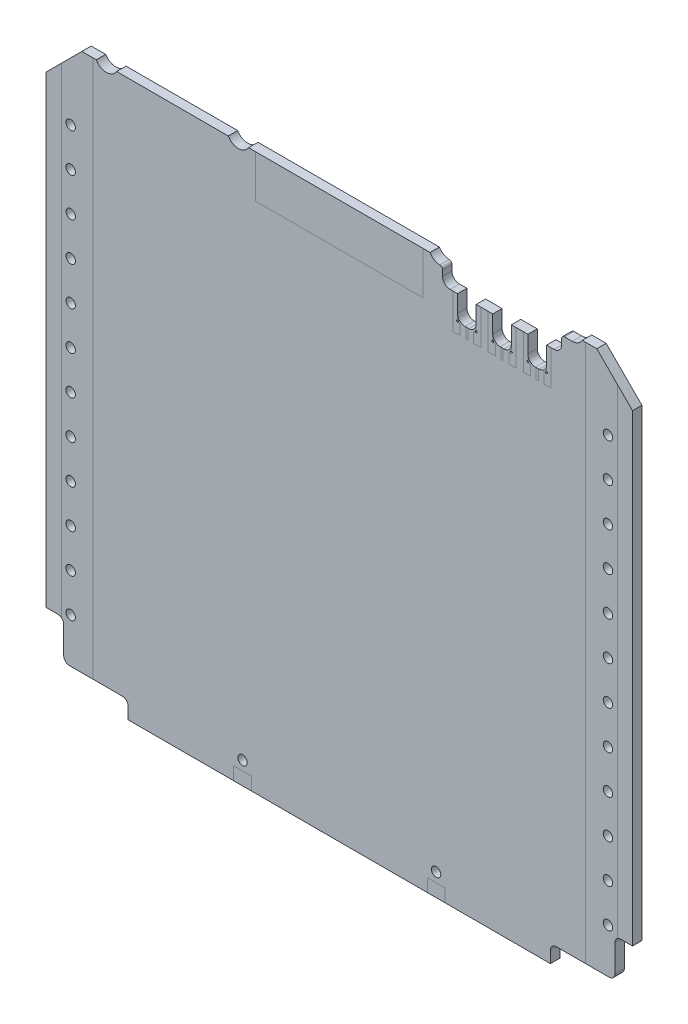
from build123d import *
from build123d.topology import SkipClean

# Parameters (mm, degrees)
SKETCH1_W                        = 100
SKETCH1_H                        = 94.75
BASICSIZE_DEPTH                  = 1.6
CHAMFER1_SIZE                    = 6.1
BACKPLANESIDESCREWCUTOUT_DEPTH   = 71.728777736
LPATTERN3_COUNT                  = 2
LPATTERN3_PITCH                  = 22.5
MIRROR3_COPY_1_DEPTH             = 71.728777736
CUT_EXTRUDE4_DEPTH               = 71.728777736
FILLET1_R                        = 1
FILLET1_OF_MIRROR1_R             = 1
SKETCH7_W                        = 28.575
SKETCH7_H                        = 7.293
TIGEREYEFOOTPRINT_DEPTH          = 0.0001
THERMALCONTACTS_UPPER_W          = 8.992158269
THERMALCONTACTS_UPPER_H          = 86.25
KEEPOUT_BOTTOM_DEPTH             = 0.0001
CAUTION_TOP_START                = -0.00015
CAUTION_TOP_DEPTH                = 0.00015
HOLD_DOWNLOCATIONS_W             = 3
HOLD_DOWNLOCATIONS_H             = 2.2
HOLD_DOWNFOOTPRINTS_DEPTH        = 0.0001
SKETCH10_W                       = 3
SKETCH10_H                       = 3.3
BOTTOMSIDESHELFKEEPOUTS_DEPTH    = 0.0001
SKETCH8_R                        = 0.8
SPRINGPINHOLESEED_DEPTH          = 10
SKETCH11_W                       = 3.18
SKETCH11_H                       = 4.2
CUT_EXTRUDE5_DEPTH               = 10
FILLET2_R                        = 1.27
F_0_32_0_32_DIAMETER_HOLE1_D     = 0.32
F_0_32_0_32_DIAMETER_HOLE1_DEPTH = 9.525
F_0_32_0_32_DIAMETER_HOLE1_TIP   = 0.096137699
SKETCH14_W                       = 0.38
SKETCH14_H                       = 1.79
BOSS_EXTRUDE1_DEPTH              = 0.0001
LPATTERN4_COUNT                  = 3
LPATTERN4_PITCH                  = 6
CUT_EXTRUDE6_DEPTH               = 71.728777736
CUT_EXTRUDE6_DEPTH_BACK          = 71.728777736
FILLET3_R                        = 0.5


# Read off the part's stored shape, not the designer's step: clearances_side-side
with BuildPart() as part:
    # Sketch1 → basicSize (new body)
    with BuildSketch(Plane(origin=(0, 0, -0.0125), x_dir=(-1, 0, 0), z_dir=(0, 0, -1))):
        with Locations((0, -2.625)):
            Rectangle(SKETCH1_W, SKETCH1_H)
    extrude(amount=-BASICSIZE_DEPTH)

    # Chamfer1
    chamfer1_edges = [part.edges().sort_by_distance(p)[0] for p in [
        (50, 44.75, 0.7875),
        (-50, 44.75, 0.7875),
    ]]
    chamfer(chamfer1_edges, length=CHAMFER1_SIZE)

    # Sketch4 → backplaneSideScrewCutout (cut, symmetric)
    with BuildSketch(Plane.XY.offset(1.5875)):
        with BuildLine():
            Line((37.967949192, 44.75), (41.432050808, 44.75))
            ThreePointArc((41.432050808, 44.75), (39.7, 43.75), (37.967949192, 44.75))
        make_face()
    backplanesidescrewcutout = extrude(amount=BACKPLANESIDESCREWCUTOUT_DEPTH, both=True, mode=Mode.SUBTRACT)

    # LPattern3: backplaneSideScrewCutout ×2
    with Locations(*[(-i * LPATTERN3_PITCH, 0, 0) for i in range(1, LPATTERN3_COUNT)]):
        add(backplanesidescrewcutout, mode=Mode.SUBTRACT)

    # Mirror3: backplaneSideScrewCutout across plane
    add(backplanesidescrewcutout.mirror(Plane(origin=(0, 0, 0), x_dir=(0, 0, 1), z_dir=(1, 0, 0))), mode=Mode.SUBTRACT)

    # Mirror3 copy 1 sketch → Mirror3 copy 1 (cut, symmetric)
    with BuildSketch(Plane(origin=(22.5, 0, 1.5875), x_dir=(-1, 0, 0), z_dir=(0, 0, 1))):
        with BuildLine():
            Line((37.967949192, -44.75), (41.432050808, -44.75))
            ThreePointArc((41.432050808, -44.75), (39.7, -43.75), (37.967949192, -44.75))
        make_face()
    extrude(amount=MIRROR3_COPY_1_DEPTH, both=True, mode=Mode.SUBTRACT)

    # Sketch6 → Cut-Extrude4 (cut, through all)
    with BuildSketch(Plane.XY.offset(1.5875)):
        Polygon((-50, -40.4), (-47, -40.4), (-47, -47), (-36, -47), (-36, -50), (-50, -50), align=None)
    cut_extrude4 = extrude(amount=-CUT_EXTRUDE4_DEPTH, mode=Mode.SUBTRACT)

    # Fillet1
    fillet1_edges = [part.edges().sort_by_distance(p)[0] for p in [
        (-47, -40.4, 0.7875),
        (-47, -47, 0.7875),
        (-36, -47, 0.7875),
    ]]
    fillet(fillet1_edges, radius=FILLET1_R)

    # Mirror1: Cut-Extrude4 across plane
    add(cut_extrude4.mirror(Plane(origin=(0, 0, 0), x_dir=(0, 0, 1), z_dir=(1, 0, 0))), mode=Mode.SUBTRACT)

    # Fillet1 of Mirror1
    fillet1_of_mirror1_edges = [part.edges().sort_by_distance(p)[0] for p in [
        (47, -40.4, 0.7875),
        (47, -47, 0.7875),
        (36, -47, 0.7875),
    ]]
    fillet(fillet1_of_mirror1_edges, radius=FILLET1_OF_MIRROR1_R)

    # Sketch7 → TigerEyeFootprint (cut)
    with BuildSketch(Plane.XY.offset(1.5875)):
        with Locations((0, 41.1035)):
            Rectangle(SKETCH7_W, SKETCH7_H)
    extrude(amount=-TIGEREYEFOOTPRINT_DEPTH, mode=Mode.SUBTRACT)

    # thermalContacts_upper → keepOut_bottom (cut)
    with BuildSketch(Plane.XY.offset(1.5875)):
        with Locations((-51.896079135, 1.625)):
            Rectangle(THERMALCONTACTS_UPPER_W, THERMALCONTACTS_UPPER_H)
    keepout_bottom = extrude(amount=-KEEPOUT_BOTTOM_DEPTH, mode=Mode.SUBTRACT)

    # Sketch3 → caution_top (cut)
    with BuildSketch(Plane.XY.offset(1.5875).offset(CAUTION_TOP_START)):
        with BuildLine():
            Line((-47.4, -41.4), (-47, -41.4))
            Line((-47, -41.4), (-47, -46))
            ThreePointArc((-47, -46), (-46.707106781, -46.707106781), (-46, -47))
            Line((-46, -47), (-42, -47))
            Line((-42, -47), (-42, 44.75))
            Line((-42, 44.75), (-47.4, 44.75))
            Line((-47.4, 44.75), (-47.4, -41.4))
        make_face()
    caution_top = extrude(amount=CAUTION_TOP_DEPTH, mode=Mode.SUBTRACT)

    # hold-downLocations → hold-downFootprints (cut)
    with BuildSketch(Plane.XY.offset(1.5875)):
        with Locations((16.5, -48.9)):
            Rectangle(HOLD_DOWNLOCATIONS_W, HOLD_DOWNLOCATIONS_H)
    hold_downfootprints = extrude(amount=-HOLD_DOWNFOOTPRINTS_DEPTH, mode=Mode.SUBTRACT)

    # clearances_top-bottom: keepOut_bottom, caution_top, hold-downFootprints across plane
    add(keepout_bottom.mirror(Plane.XY.offset(0.7875)), mode=Mode.SUBTRACT)
    add(caution_top.mirror(Plane.XY.offset(0.7875)), mode=Mode.SUBTRACT)
    add(hold_downfootprints.mirror(Plane.XY.offset(0.7875)), mode=Mode.SUBTRACT)

    # clearances_side-side: part across plane


with BuildPart() as part_1:
    add(part.part)
    add(part.part.mirror(Plane(origin=(0, 0, 0), x_dir=(0, 0, 1), z_dir=(1, 0, 0))))

    # Sketch10 → bottomsideShelfKeepouts (cut)
    with BuildSketch(Plane(origin=(0, 0, -0.0125), x_dir=(-1, 0, 0), z_dir=(0, 0, -1))):
        with Locations((-16.5, -46.15)):
            Rectangle(SKETCH10_W, SKETCH10_H)
        with Locations((16.5, -46.15)):
            Rectangle(SKETCH10_W, SKETCH10_H)
    extrude(amount=-BOTTOMSIDESHELFKEEPOUTS_DEPTH, mode=Mode.SUBTRACT)

    # Sketch8 → springPinHoleSeed (cut)
    with BuildSketch(Plane.XY.offset(1.5875)):
        with Locations((-45.8, 32.95)):
            Circle(SKETCH8_R)
        with Locations((-45.8, 26.372727273)):
            Circle(SKETCH8_R)
        with Locations((-45.8, 19.795454545)):
            Circle(SKETCH8_R)
        with Locations((-45.8, 13.218181818)):
            Circle(SKETCH8_R)
        with Locations((-45.8, 6.640909091)):
            Circle(SKETCH8_R)
        with Locations((-45.8, 0.063636364)):
            Circle(SKETCH8_R)
        with Locations((-45.8, -6.513636364)):
            Circle(SKETCH8_R)
        with Locations((-45.8, -13.090909091)):
            Circle(SKETCH8_R)
        with Locations((-45.8, -19.668181818)):
            Circle(SKETCH8_R)
        with Locations((-45.8, -26.245454545)):
            Circle(SKETCH8_R)
        with Locations((-45.8, -32.822727273)):
            Circle(SKETCH8_R)
        with Locations((-45.8, -39.4)):
            Circle(SKETCH8_R)
        with Locations((-16.5, -46.2)):
            Circle(SKETCH8_R)
    springpinholeseed = extrude(amount=-SPRINGPINHOLESEED_DEPTH, mode=Mode.SUBTRACT)

    # Mirror4: springPinHoleSeed across plane
    add(springpinholeseed.mirror(Plane(origin=(0, 0, 0), x_dir=(0, 0, 1), z_dir=(1, 0, 0))), mode=Mode.SUBTRACT)

    # Sketch11 → Cut-Extrude5 (cut)
    with BuildSketch(Plane.XY.offset(1.5875)):
        with Locations((33.75, 38.91)):
            Rectangle(SKETCH11_W, SKETCH11_H)
        with Locations((27.75, 38.91)):
            Rectangle(SKETCH11_W, SKETCH11_H)
        with Locations((21.75, 38.91)):
            Rectangle(SKETCH11_W, SKETCH11_H)
    extrude(amount=-CUT_EXTRUDE5_DEPTH, mode=Mode.SUBTRACT)

    # Fillet2
    fillet2_edges = [part_1.edges().sort_by_distance(p)[0] for p in [
        (35.34, 36.81, 0.7875),
        (32.16, 36.81, 0.7875),
        (29.34, 36.81, 0.7875),
        (26.16, 36.81, 0.7875),
        (23.34, 36.81, 0.7875),
        (20.16, 36.81, 0.7875),
    ]]
    fillet(fillet2_edges, radius=FILLET2_R)

    # Ø0.32 (0.32) Diameter Hole1
    with Locations(Plane.XY.offset(1.5875)):
        with Locations((35.34, 36.97), (32.16, 36.97), (29.34, 36.97), (26.16, 36.97), (23.34, 36.97), (20.16, 36.97)):
            Hole(F_0_32_0_32_DIAMETER_HOLE1_D / 2, depth=F_0_32_0_32_DIAMETER_HOLE1_DEPTH)
            with Locations((0, 0, -(F_0_32_0_32_DIAMETER_HOLE1_DEPTH + F_0_32_0_32_DIAMETER_HOLE1_TIP / 2))):  # 118° drill point
                Cone(0, F_0_32_0_32_DIAMETER_HOLE1_D / 2, F_0_32_0_32_DIAMETER_HOLE1_TIP, mode=Mode.SUBTRACT)

    # Sketch14 → Boss-Extrude1 (add)
    with SkipClean():  # the faces are left unmerged after this step: merging them gives an invalid solid
        with BuildSketch(Plane.XY.offset(1.5875)):
            with BuildLine():
                ThreePointArc((32.16, 37.13), (32, 36.97), (32.16, 36.81))
                Line((32.16, 36.81), (32.605, 36.81))
                Line((32.605, 36.81), (32.605, 35.02))
                Line((32.605, 35.02), (31.375, 35.02))
                Line((31.375, 35.02), (31.375, 41.01))
                Line((31.375, 41.01), (32.16, 41.01))
                Line((32.16, 41.01), (32.16, 38.08))
                Line((32.16, 38.08), (32.16, 37.13))
            make_face()
            with Locations((33.75, 35.915)):
                Rectangle(SKETCH14_W, SKETCH14_H)
            with BuildLine():
                ThreePointArc((35.34, 36.81), (35.5, 36.97), (35.34, 37.13))
                Line((35.34, 37.13), (35.34, 38.08))
                Line((35.34, 38.08), (35.34, 41.01))
                Line((35.34, 41.01), (36.125, 41.01))
                Line((36.125, 41.01), (36.125, 35.02))
                Line((36.125, 35.02), (34.895, 35.02))
                Line((34.895, 35.02), (34.895, 36.81))
                Line((34.895, 36.81), (35.34, 36.81))
            make_face()
        boss_extrude1 = extrude(amount=BOSS_EXTRUDE1_DEPTH)
    add(part_1.part.scale(1), mode=Mode.REPLACE)  # the faces are merged on a copy

    # LPattern4: Boss-Extrude1 ×3
    with Locations(*[(-i * LPATTERN4_PITCH, 0, 0) for i in range(1, LPATTERN4_COUNT)]):
        add(boss_extrude1)

    # Sketch15 → Cut-Extrude6 (cut, two sides: drawn at the far end of the back side and taken through both)
    with BuildSketch(Plane.XY.offset(1.5875).offset(-CUT_EXTRUDE6_DEPTH_BACK)):
        with BuildLine():
            Line((17.605, 44.75), (37.895, 44.75))
            Line((37.895, 44.75), (39.7, 44.75))
            Line((39.7, 44.75), (39.7, 43.75))
            Line((39.7, 43.75), (37.895, 43.75))
            Line((37.895, 43.75), (37.895, 42.28))
            ThreePointArc((37.895, 42.28), (37.523025612, 41.381974388), (36.625, 41.01))
            Line((36.625, 41.01), (18.875, 41.01))
            ThreePointArc((18.875, 41.01), (17.976974388, 41.381974388), (17.605, 42.28))
            Line((17.605, 42.28), (17.605, 43.75))
            Line((17.605, 43.75), (17.2, 43.75))
            Line((17.2, 43.75), (17.2, 44.75))
            Line((17.2, 44.75), (17.605, 44.75))
        make_face()
    extrude(amount=CUT_EXTRUDE6_DEPTH + CUT_EXTRUDE6_DEPTH_BACK, mode=Mode.SUBTRACT)

    # Fillet3
    fillet3_edges = [part_1.edges().sort_by_distance(p)[0] for p in [
        (17.605, 43.75, 0.7875),
        (37.895, 43.75, 0.7875),
    ]]
    fillet(fillet3_edges, radius=FILLET3_R)


solid = part_1.part
